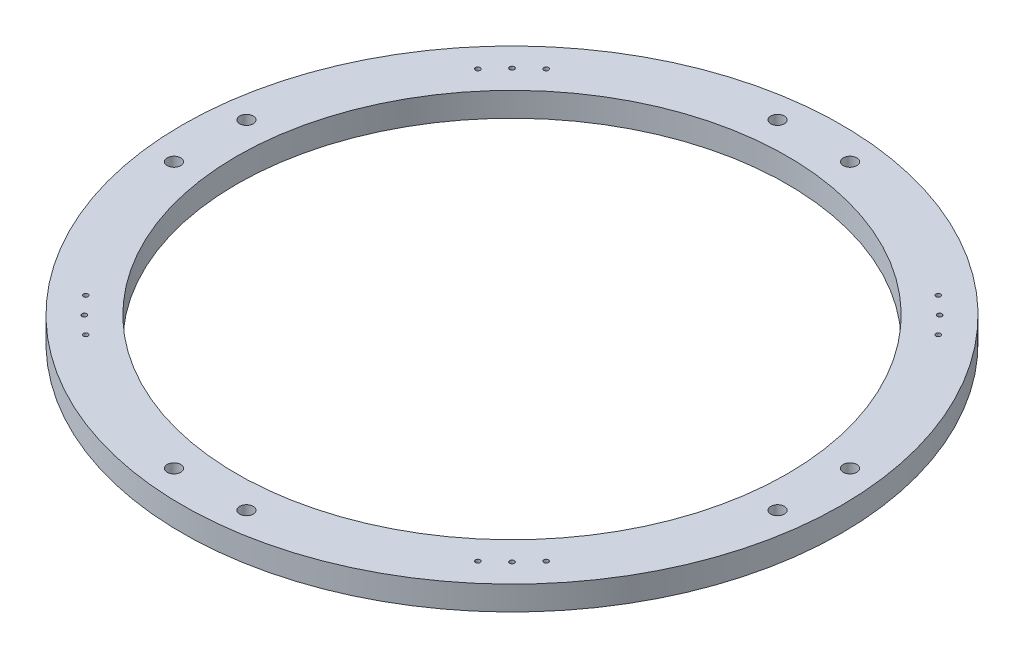
from build123d import *

# Parameters (mm, degrees)
SKETCH1_W                   = 28.575
SKETCH1_H                   = 12.7
TAP_DRILL_FOR_M3X0_5_TAP1_D = 2.5
SKETCH7_R                   = 3.571875
CUT_EXTRUDE1_DEPTH          = 246.374591076
CIRPATTERN1_COUNT           = 4


with BuildPart() as part:
    # Sketch1 → Revolve1 (revolve)
    with BuildSketch(Plane.XY):
        with Locations((158.985983179, 204.413736754)):
            Rectangle(SKETCH1_W, SKETCH1_H)
    revolve(axis=Axis((1e-09, -200000, 0), (0, 1, 0)))

    # Tap Drill for M3x0.5 Tap1 (through all)
    with Locations(Plane(origin=(0, 210.763736754, 0), x_dir=(1, 0, 0), z_dir=(0, 1, 0))):
        with Locations((-112.420066819, 112.420066819), (-103.080559616, 121.041071858), (-121.041071858, 103.080559616)):
            tap_drill_for_m3x0_5_tap1 = Hole(TAP_DRILL_FOR_M3X0_5_TAP1_D / 2)

    # Sketch7 → Cut-Extrude1 (cut, through all)
    with BuildSketch(Plane(origin=(0, 210.763736754, 0), x_dir=(1, 0, 0), z_dir=(0, 1, 0))):
        with Locations((158.674245572, -19.05)):
            Circle(SKETCH7_R)
        with Locations((158.674245572, 19.05)):
            Circle(SKETCH7_R)
    cut_extrude1 = extrude(amount=-CUT_EXTRUDE1_DEPTH, mode=Mode.SUBTRACT)

    # CirPattern1: Tap Drill for M3x0.5 Tap1, Cut-Extrude1 ×4 about axis
    cirpattern1_axis = Axis((1e-09, -200000, 0), (0, -1, 0))
    add([tap_drill_for_m3x0_5_tap1.rotate(cirpattern1_axis, i * 360 / CIRPATTERN1_COUNT) for i in range(1, CIRPATTERN1_COUNT)], mode=Mode.SUBTRACT)
    add([cut_extrude1.rotate(cirpattern1_axis, i * 360 / CIRPATTERN1_COUNT) for i in range(1, CIRPATTERN1_COUNT)], mode=Mode.SUBTRACT)


solid = part.part
